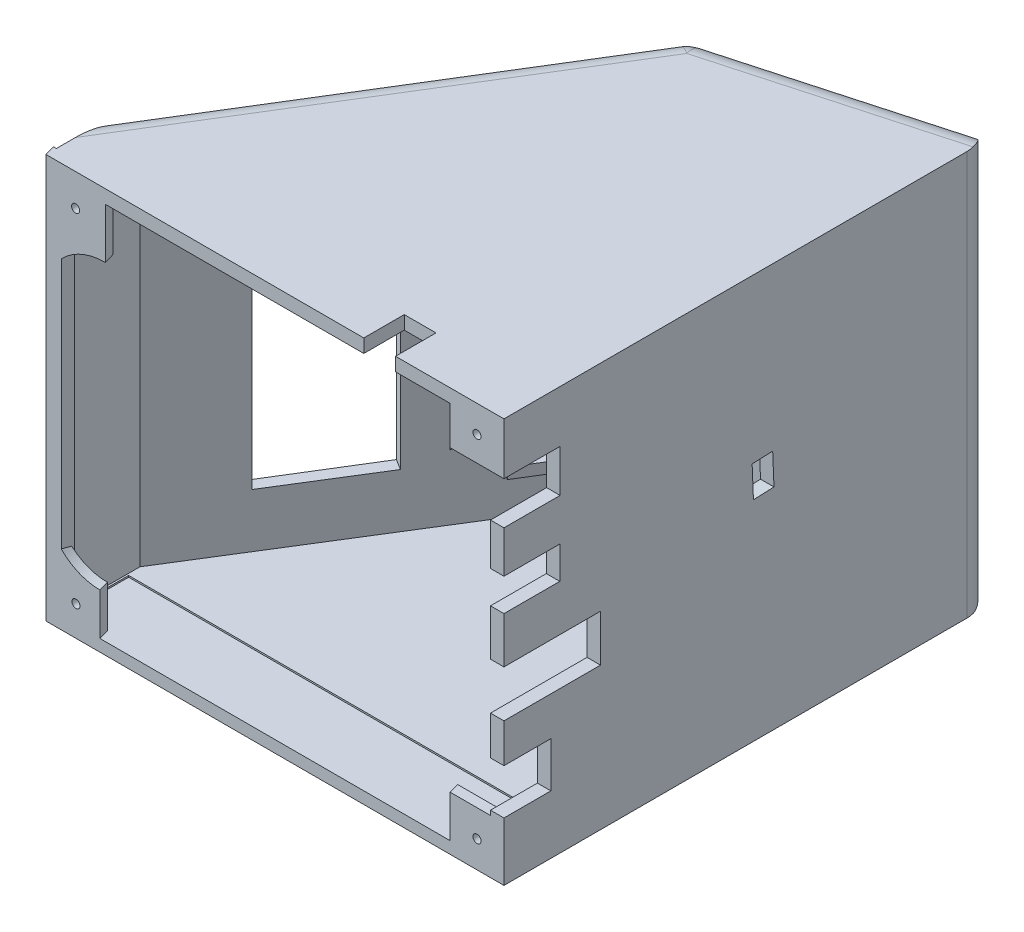
from build123d import *

# Parameters (mm, degrees)
ESBO_O1_W                  = 170
ESBO_O1_H                  = 30
RESSALTO_EXTRUS_O1_DEPTH   = 150
CORTE_EXTRUS_O1_DEPTH      = 222
CORTE_EXTRUS_O1_DEPTH_BACK = 36
RESSALTO_EXTRUS_O2_DEPTH   = 5
RESSALTO_EXTRUS_O3_DEPTH   = 5
ESBO_O4_W                  = 159.333333333
ESBO_O4_H                  = 140.588235294
CORTE_EXTRUS_O2_DEPTH      = 25
CORTE_EXTRUS_O3_DEPTH      = 31
CORTE_EXTRUS_O4_DEPTH      = 42
FILETE1_R                  = 10
CORTE_EXTRUS_O5_DEPTH      = 32
CORTE_EXTRUS_O6_START      = -15.72292277
CORTE_EXTRUS_O6_OUTLINE_R  = 3.95
CORTE_EXTRUS_O6_DEPTH      = 4.876648775
CORTE_EXTRUS_O7_START      = -132.751356438
CORTE_EXTRUS_O7_OUTLINE_R  = 3.95
CORTE_EXTRUS_O7_DEPTH      = 3.479370229
RESSALTO_EXTRUS_O6_DEPTH   = 17
RESSALTO_EXTRUS_O7_DEPTH   = 4
CORTE_EXTRUS_O8_DEPTH      = 21
F_3DSKETCH12_R             = 1.5
CORTE_EXTRUS_O9_DEPTH      = 14
CORTE_EXTRUS_O10_DEPTH     = 19
ESBO_O11_W                 = 17.407525744
ESBO_O11_H                 = 16.792397695
CORTE_EXTRUS_O11_DEPTH     = 10
CORTE_EXTRUS_O12_DEPTH     = 20
CORTE_EXTRUS_O13_DEPTH     = 14


# Read off the part's stored shape, not the designer's step: Corte-extrusão6, Corte-extrusão7
with BuildPart() as part:
    # Esboço1 → Ressalto-extrusão1 (new body)
    with BuildSketch(Plane(origin=(0, 0, 0), x_dir=(1, 0, 0), z_dir=(0, 1, 0))):
        with Locations((85, 15)):
            Rectangle(ESBO_O1_W, ESBO_O1_H)
        Polygon((80, 160), (0, 30), (170, 30), (170, 160), align=None)
        Polygon((170, 160), (170, 185), (80, 160), align=None)
    extrude(amount=RESSALTO_EXTRUS_O1_DEPTH)

    # Esboço2 → Corte-extrusão1 (cut, two sides: drawn at the far end of the back side and taken through both)
    with BuildSketch(Plane(origin=(0, 0, 0), x_dir=(1, 0, 0), z_dir=(0, 1, 0)).offset(-CORTE_EXTRUS_O1_DEPTH_BACK)):
        Polygon((84.391050739, 157.608625205), (165, 180), (165, 5), (5, 5), (5, 29.866892941), align=None)
    extrude(amount=CORTE_EXTRUS_O1_DEPTH + CORTE_EXTRUS_O1_DEPTH_BACK, mode=Mode.SUBTRACT)

    # Esboço3 → Ressalto-extrusão2 (add)
    with BuildSketch(Plane(origin=(0, 0, 0), x_dir=(1, 0, 0), z_dir=(0, 1, 0))):
        Polygon((84.391050739, 157.608625205), (165, 180), (165, 5), (5, 5), (5, 29.866892941), align=None)
    extrude(amount=RESSALTO_EXTRUS_O2_DEPTH)

    # 3DSketch2 → Ressalto-extrusão3 (add)
    with BuildSketch(Plane(origin=(165, 150, -5), x_dir=(0, 0, -1), z_dir=(0, 1, 0))):
        Polygon((0, 0), (0, 160), (24.866892941, 160), (152.608625205, 80.608949261), (175, 0), align=None)
    extrude(amount=-RESSALTO_EXTRUS_O3_DEPTH)

    # Esboço4 → Corte-extrusão2 (cut)
    with BuildSketch(Plane.XY):
        with Locations((85.333333333, 74.705882353)):
            Rectangle(ESBO_O4_W, ESBO_O4_H)
    extrude(amount=-CORTE_EXTRUS_O2_DEPTH, mode=Mode.SUBTRACT)

    # 3DSketch3 → Corte-extrusão3 (cut)
    with BuildSketch(Plane(origin=(74.759025743, 90, -151.483416833), x_dir=(-0.29071694485714406, -0.8320502943378435, 0.4724150353928592), z_dir=(-0.8516583167045438, 0, -0.5240974256643346))):
        Polygon((0, 0), (22.188007849, 33.282011774), (72.111025509, 0), (49.92301766, -33.282011774), align=None)
    extrude(amount=-CORTE_EXTRUS_O3_DEPTH, mode=Mode.SUBTRACT)

    # 3DSketch4 → Corte-extrusão4 (cut)
    with BuildSketch(Plane(origin=(69.518051487, 130, -142.966833666), x_dir=(-0.37059284368967266, -0.7071067811865471, 0.6022133709956982), z_dir=(0.8516583167045362, 0, 0.5240974256643472))):
        Polygon((0, 0), (14.142135624, -14.142135624), (28.284271247, 0), (14.142135624, 14.142135624), align=None)
    extrude(amount=CORTE_EXTRUS_O4_DEPTH, mode=Mode.SUBTRACT)

    # Filete1
    filete1_edges = [part.edges().sort_by_distance(p)[0] for p in [
        (170, 75, -185),
        (125, 0, -172.5),
        (125, 150, -172.5),
        (80, 75, -160),
        (40, 0, -95),
        (40, 150, -95),
        (0, 75, -30),
        (84.391050739, 75, -157.608625205),
    ]]
    fillet(filete1_edges, radius=FILETE1_R)

    # 3DSketch5 → Corte-extrusão5 (cut)
    with BuildSketch(Plane(origin=(38.121221288, 25, -91.946984593), x_dir=(-0.194644897392922, 0.9284766908852593, 0.31629795826349816), z_dir=(0.851658316704544, 0, 0.5240974256643347))):
        Polygon((0, 0), (14.855627054, 37.139067635), (107.703296143, 0), (92.847669089, -37.139067635), align=None)
    extrude(amount=CORTE_EXTRUS_O5_DEPTH, mode=Mode.SUBTRACT)

    # Corte-extrusão6 outline → Corte-extrusão6 (cut)
    with BuildSketch(Plane(origin=(0, 0, 0), x_dir=(0.5240974256643349, 0, -0.8516583167045437), z_dir=(0.8516583167045437, 0, 0.5240974256643349)).offset(CORTE_EXTRUS_O6_START)):
        with Locations((148.193124726, 20)):
            Circle(CORTE_EXTRUS_O6_OUTLINE_R)
    extrude(amount=CORTE_EXTRUS_O6_DEPTH, mode=Mode.SUBTRACT)

    # Corte-extrusão7 outline → Corte-extrusão7 (cut)
    with BuildSketch(Plane(origin=(0, 0, 0), x_dir=(0.9635179096299408, 0, -0.267643863786094), z_dir=(0.267643863786094, 0, 0.9635179096299409)).offset(CORTE_EXTRUS_O7_START)):
        with Locations((161.993020775, 122.164347625)):
            Circle(CORTE_EXTRUS_O7_OUTLINE_R)
    extrude(amount=CORTE_EXTRUS_O7_DEPTH, mode=Mode.SUBTRACT)

    # 3DSketch9 → Ressalto-extrusão6 (add)
    with BuildSketch(Plane(origin=(76.350750718, 26, -154.069969916), x_dir=(-0.29815073011621673, 0.8224176546598938, 0.4844949364388514), z_dir=(0.8516583167045438, 0, 0.5240974256643349))):
        Polygon((0, 0), (26.758649409, 38.684123705), (82.683049926, 0), (55.924400517, -38.684123705), align=None)
        Polygon((5.017416454, 0.222210211), (27.772783339, 33.118916398), (77.117842619, -1.01413393), (54.362475733, -33.910840117), align=None, mode=Mode.SUBTRACT)
    extrude(amount=RESSALTO_EXTRUS_O6_DEPTH)

    # 3DSketch10 → Ressalto-extrusão7 (add, along a direction that is not the sketch's normal)
    with BuildSketch(Plane(origin=(0, 0, 0), x_dir=(0.7498378553650926, 0.6616216370868463, 0), z_dir=(0, 0, 1))):
        with BuildLine():
            Line((0, 0), (14.996757107, -13.232432742))
            Line((14.996757107, -13.232432742), (28.229189849, 1.764324366))
            ThreePointArc((28.229189849, 1.764324366), (21.556867541, 14.536675999), (25.141622209, 28.493838504))
            Line((25.141622209, 28.493838504), (13.232432742, 14.996757107))
            Line((13.232432742, 14.996757107), (0, 0))
        make_face()
        with BuildLine():
            Line((99.243245563, 112.475678305), (115.742930564, 97.917132715))
            Line((115.742930564, 97.917132715), (100.070543679, 80.155094246))
            ThreePointArc((100.070543679, 80.155094246), (86.055529464, 85.755516688), (71.66166921, 81.216558438))
            Line((71.66166921, 81.216558438), (83.570858678, 94.713639835))
            Line((83.570858678, 94.713639835), (99.243245563, 112.475678305))
        make_face()
        Polygon((226.715680975, 0), (211.718923868, 13.232432742), (198.486491126, -1.764324366), (213.483248233, -14.996757107), align=None)
        Polygon((127.472435412, -112.475678305), (112.475678305, -99.243245563), (125.708111047, -84.246488456), (140.704868154, -97.478921197), align=None)
    extrude(amount=-RESSALTO_EXTRUS_O7_DEPTH, dir=(0.26764386378609445, 0, 0.9635179096299407))

    # 3DSketch11 → Corte-extrusão8 (cut)
    with BuildSketch(Plane(origin=(153.100052242, 17.26943239, -180.305570067), x_dir=(-0.07376023038027929, 0.9970655099962036, 0.02048895288341091), z_dir=(0.2676438637860946, 0, 0.9635179096299407))):
        Polygon((0, 0), (0.269964353, 3.516152018), (46.066103253, 0), (45.7961389, -3.516152018), align=None)
    extrude(amount=CORTE_EXTRUS_O8_DEPTH, mode=Mode.SUBTRACT)

    # 3DSketch12 → Corte-extrusão9 (cut)
    with BuildSketch(Plane(origin=(160, 140, 0), x_dir=(-0.7560654573770964, -0.6544960077503622, 0), z_dir=(0, 0, 1))):
        with Locations(Location((0, 0, 0), (0, 0, 319.118554366))):
            Circle(F_3DSKETCH12_R)
        with Locations(Location((85.084481008, 98.288509459, 0), (0, 0, 319.118554366))):
            Circle(F_3DSKETCH12_R)
        with Locations(Location((113.858951537, -96.124361942, 0), (0, 0, 139.118554366))):
            Circle(F_3DSKETCH12_R)
        with Locations(Location((196.909602971, 0, 0), (0, 0, 139.118554366))):
            Circle(F_3DSKETCH12_R)
    extrude(amount=-CORTE_EXTRUS_O9_DEPTH, mode=Mode.SUBTRACT)

    # 3DSketch13 → Corte-extrusão10 (cut)
    with BuildSketch(Plane(origin=(170, 70.245878967, 0), x_dir=(0, -0.4354246522459521, -0.9002251786172678), z_dir=(-1, 0, 0))):
        Polygon((0, 0), (32.261446294, -15.604350297), (39.809023237, 0), (7.547576943, 15.604350297), align=None)
    extrude(amount=CORTE_EXTRUS_O10_DEPTH, mode=Mode.SUBTRACT)

    # Esboço11 → Corte-extrusão11 (cut)
    with BuildSketch(Plane(origin=(170, 0, 0), x_dir=(0, 0, -1), z_dir=(1, 0, 0))):
        with Locations((8.703762872, 30.096304842)):
            Rectangle(ESBO_O11_W, ESBO_O11_H)
    extrude(amount=-CORTE_EXTRUS_O11_DEPTH, mode=Mode.SUBTRACT)

    # 3DSketch14 → Corte-extrusão12 (cut)
    with BuildSketch(Plane(origin=(170, 87.396079578, 0), x_dir=(0, -0.09341146144778735, -0.9956275904524686), z_dir=(1, 0, 0))):
        Polygon((0, 0), (20.627912038, 1.935345533), (19.506160301, 13.891554783), (-1.121751737, 11.956209249), align=None)
        Polygon((-2.576084268, 27.457236328), (18.165947056, 29.403288726), (16.691971594, 45.113680317), (-4.050059731, 43.167627919), align=None)
        Polygon((91.534016736, 10.656116635), (99.096194716, 11.679615344), (100.676965661, 0), (93.114787682, -1.02349871), align=None)
    extrude(amount=-CORTE_EXTRUS_O12_DEPTH, mode=Mode.SUBTRACT)

    # 3DSketch15 → Corte-extrusão13 (cut)
    with BuildSketch(Plane(origin=(129.748977416, 150, 0), x_dir=(-0.6170578351280018, 0, -0.7869178026370631), z_dir=(0, -1, 0))):
        Polygon((0, 0), (11.819817446, 9.268453377), (19.087630878, 0), (7.267813432, -9.268453377), align=None)
    extrude(amount=CORTE_EXTRUS_O13_DEPTH, mode=Mode.SUBTRACT)


solid = part.part
